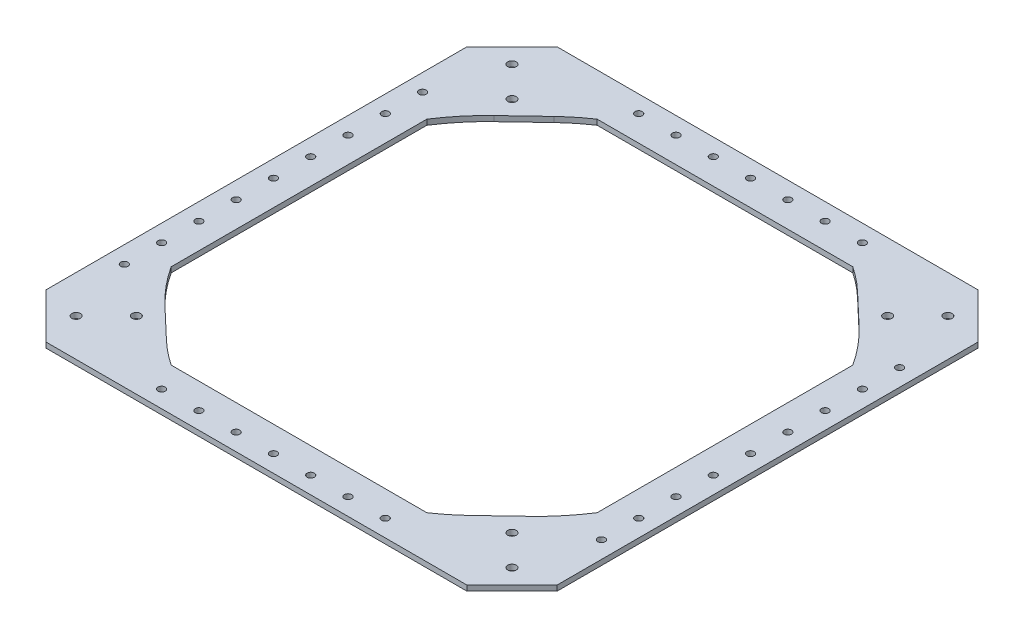
from build123d import *

# Parameters (mm, degrees)
BOSS_EXTRUDE1_DEPTH = 3.175
CUT_EXTRUDE1_DEPTH  = 260.167577975
SKETCH4_R           = 2.159
CUT_EXTRUDE2_DEPTH  = 260.167577975
SKETCH5_R           = 2.54
CUT_EXTRUDE3_DEPTH  = 260.167577975


with BuildPart() as part:
    # Sketch1 → Boss-Extrude1 (new body)
    with BuildSketch(Plane(origin=(0, 0, 0), x_dir=(1, 0, 0), z_dir=(0, 1, 0))):
        Polygon((-152.4, 68.259630377), (-125.459231637, 95.20039874), (125.459231637, 95.20039874), (152.4, 68.259630377), (152.4, -182.658832897), (125.459231637, -209.59960126), (-125.459231637, -209.59960126), (-152.4, -182.658832897), align=None)
    extrude(amount=BOSS_EXTRUDE1_DEPTH)

    # Sketch2 → Cut-Extrude1 (cut, through all)
    with BuildSketch(Plane(origin=(0, 3.175, 0), x_dir=(1, 0, 0), z_dir=(0, 1, 0))):
        with BuildLine():
            Line((-76.2, 69.80039874), (76.2, 69.80039874))
            ThreePointArc((76.2, 69.80039874), (83.574866465, 64.389558753), (90.466102896, 58.374851345))
            Line((90.466102896, 58.374851345), (108.872886248, 40.883979244))
            ThreePointArc((108.872886248, 40.883979244), (118.588914094, 30.482658843), (127, 19.00039874))
            Line((127, 19.00039874), (127, -133.39960126))
            ThreePointArc((127, -133.39960126), (118.588914094, -144.881861364), (108.872886248, -155.283181764))
            Line((108.872886248, -155.283181764), (90.466102896, -172.774053866))
            ThreePointArc((90.466102896, -172.774053866), (83.574866465, -178.788761273), (76.2, -184.19960126))
            Line((76.2, -184.19960126), (-76.2, -184.19960126))
            ThreePointArc((-76.2, -184.19960126), (-83.574866465, -178.788761273), (-90.466102896, -172.774053866))
            Line((-90.466102896, -172.774053866), (-108.872886248, -155.283181764))
            ThreePointArc((-108.872886248, -155.283181764), (-118.588914094, -144.881861364), (-127, -133.39960126))
            Line((-127, -133.39960126), (-127, 19.00039874))
            ThreePointArc((-127, 19.00039874), (-118.588914094, 30.482658843), (-108.872886248, 40.883979244))
            Line((-108.872886248, 40.883979244), (-90.466102896, 58.374851345))
            ThreePointArc((-90.466102896, 58.374851345), (-83.574866465, 64.389558753), (-76.2, 69.80039874))
        make_face()
    extrude(amount=-CUT_EXTRUDE1_DEPTH, mode=Mode.SUBTRACT)

    # Sketch4 → Cut-Extrude2 (cut, through all)
    with BuildSketch(Plane(origin=(0, 3.175, 0), x_dir=(1, 0, 0), z_dir=(0, 1, 0))):
        with Locations((0, 85.04039874)):
            Circle(SKETCH4_R)
        with Locations((-44.45, 85.04039874)):
            Circle(SKETCH4_R)
        with Locations((44.45, 85.04039874)):
            Circle(SKETCH4_R)
        with Locations((-22.225, 85.04039874)):
            Circle(SKETCH4_R)
        with Locations((22.225, 85.04039874)):
            Circle(SKETCH4_R)
        with Locations((-142.24, -57.19960126)):
            Circle(SKETCH4_R)
        with Locations((-142.24, -34.97460126)):
            Circle(SKETCH4_R)
        with Locations((-142.24, -12.74960126)):
            Circle(SKETCH4_R)
        with Locations((142.24, -57.19960126)):
            Circle(SKETCH4_R)
        with Locations((142.24, -34.97460126)):
            Circle(SKETCH4_R)
        with Locations((142.24, -12.74960126)):
            Circle(SKETCH4_R)
        with Locations((142.24, -101.64960126)):
            Circle(SKETCH4_R)
        with Locations((142.24, -79.42460126)):
            Circle(SKETCH4_R)
        with Locations((-142.24, -101.64960126)):
            Circle(SKETCH4_R)
        with Locations((-142.24, -79.42460126)):
            Circle(SKETCH4_R)
        with Locations((22.225, -199.43960126)):
            Circle(SKETCH4_R)
        with Locations((-22.225, -199.43960126)):
            Circle(SKETCH4_R)
        with Locations((44.45, -199.43960126)):
            Circle(SKETCH4_R)
        with Locations((-44.45, -199.43960126)):
            Circle(SKETCH4_R)
        with Locations((0, -199.43960126)):
            Circle(SKETCH4_R)
        with Locations((-66.675, 85.04039874)):
            Circle(SKETCH4_R)
        with Locations((66.675, 85.04039874)):
            Circle(SKETCH4_R)
        with Locations((-142.24, 9.47539874)):
            Circle(SKETCH4_R)
        with Locations((142.24, 9.47539874)):
            Circle(SKETCH4_R)
        with Locations((142.24, -123.87460126)):
            Circle(SKETCH4_R)
        with Locations((66.675, -199.43960126)):
            Circle(SKETCH4_R)
        with Locations((-66.675, -199.43960126)):
            Circle(SKETCH4_R)
        with Locations((-142.24, -123.87460126)):
            Circle(SKETCH4_R)
        with Locations((-142.24, -146.09960126)):
            Circle(SKETCH4_R)
        with Locations((-142.24, 31.70039874)):
            Circle(SKETCH4_R)
        with Locations((142.24, 31.70039874)):
            Circle(SKETCH4_R)
        with Locations((142.24, -146.09960126)):
            Circle(SKETCH4_R)
    extrude(amount=-CUT_EXTRUDE2_DEPTH, mode=Mode.SUBTRACT)

    # Sketch5 → Cut-Extrude3 (cut, through all)
    with BuildSketch(Plane(origin=(0, 3.175, 0), x_dir=(1, 0, 0), z_dir=(0, 1, 0))):
        with Locations((-129.949359697, 72.749758437)):
            Circle(SKETCH5_R)
        with Locations((-111.988847455, 54.789246195)):
            Circle(SKETCH5_R)
        with Locations((111.988847455, 54.789246195)):
            Circle(SKETCH5_R)
        with Locations((129.949359697, 72.749758437)):
            Circle(SKETCH5_R)
        with Locations((129.949359697, -187.148960958)):
            Circle(SKETCH5_R)
        with Locations((111.988847455, -169.188448715)):
            Circle(SKETCH5_R)
        with Locations((-111.988847455, -169.188448715)):
            Circle(SKETCH5_R)
        with Locations((-129.949359697, -187.148960958)):
            Circle(SKETCH5_R)
    extrude(amount=-CUT_EXTRUDE3_DEPTH, mode=Mode.SUBTRACT)


solid = part.part
